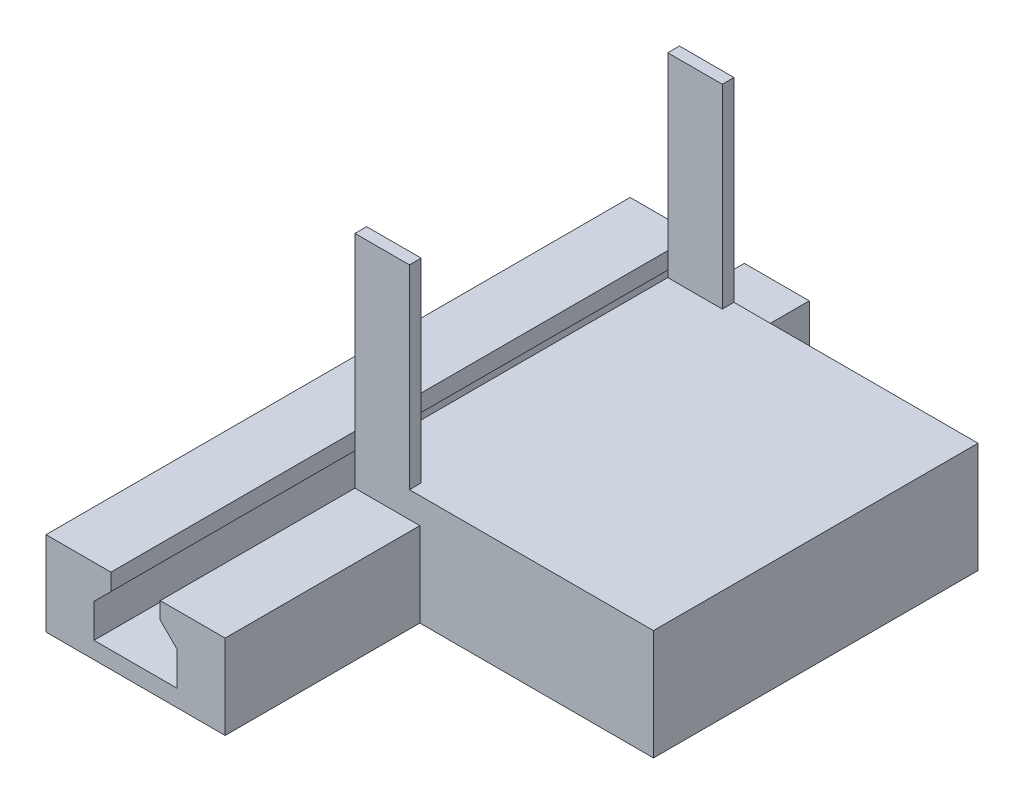
from build123d import *

# Parameters (mm, degrees)
BOSS_EXTRU_1_DEPTH           = 45
ESQUISSE6_W                  = 25
ESQUISSE6_H                  = 7.5
BOSS_EXTRU_6_DEPTH           = 18
ESQUISSE7_W                  = 23
ESQUISSE7_H                  = 25
BOSS_EXTRU_7_DEPTH           = 2
ESQUISSE8_W                  = 4.2
ESQUISSE8_H                  = 0.9
BOSS_EXTRU_8_DEPTH           = 20
BOSS_EXTRU_9_DEPTH           = 10
BOSS_EXTRU_9_DEPTH_BACK      = 5
ESQUISSE9_W                  = 23
ESQUISSE9_H                  = 25
ESQUISSE10_R                 = 4
ENL_V_MAT_EXTRU_1_DEPTH      = 67.483682208
ESQUISSE12_W                 = 23
ESQUISSE12_H                 = 15
ENL_V_MAT_EXTRU_2_DEPTH      = 54.887382568
ENL_V_MAT_EXTRU_3_DEPTH      = 45.86479689
ENL_V_MAT_EXTRU_3_DEPTH_BACK = 45.86479689
ESQUISSE13_W                 = 31.8
ESQUISSE13_H                 = 1


with BuildPart() as part:
    # Esquisse1 → Boss.-Extru.1 (new body)
    with BuildSketch(Plane.XY):
        Polygon((-3.2, 0), (3.2, 0), (3.2, 2.6), (1.9, 3.9), (1.9, 5.2), (6.9, 5.2), (6.9, -2.3), (-6.9, -2.3), (-6.9, 5.2), (-1.9, 5.2), (-1.9, 3.9), (-3.2, 2.6), align=None)
    extrude(amount=BOSS_EXTRU_1_DEPTH)

    # Esquisse6 → Boss.-Extru.6 (add)
    with BuildSketch(Plane(origin=(6.9, 0, 0), x_dir=(0, 0, -1), z_dir=(1, 0, 0))):
        with Locations((-17.5, 1.45)):
            Rectangle(ESQUISSE6_W, ESQUISSE6_H)
    extrude(amount=BOSS_EXTRU_6_DEPTH)

    # Esquisse7 → Boss.-Extru.7 (add)
    with BuildSketch(Plane(origin=(0, 5.2, 0), x_dir=(1, 0, 0), z_dir=(0, 1, 0))):
        with Locations((13.4, -17.5)):
            Rectangle(ESQUISSE7_W, ESQUISSE7_H)
    extrude(amount=BOSS_EXTRU_7_DEPTH)

    # Esquisse8 → Boss.-Extru.8 (add)
    with BuildSketch(Plane(origin=(0, 7.2, 0), x_dir=(1, 0, 0), z_dir=(0, 1, 0))):
        with Locations((4, -29.55)):
            Rectangle(ESQUISSE8_W, ESQUISSE8_H)
        with Locations((4, -5.45)):
            Rectangle(ESQUISSE8_W, ESQUISSE8_H)
    extrude(amount=BOSS_EXTRU_8_DEPTH)

    # Esquisse9 → Boss.-Extru.9 (add, two sides: drawn at the far end of the back side and taken through both)
    with BuildSketch(Plane(origin=(0, 27.2, 0), x_dir=(1, 0, 0), z_dir=(0, 1, 0)).offset(-BOSS_EXTRU_9_DEPTH_BACK)):
        with Locations((13.4, -17.5)):
            Rectangle(ESQUISSE9_W, ESQUISSE9_H)
    extrude(amount=BOSS_EXTRU_9_DEPTH + BOSS_EXTRU_9_DEPTH_BACK)

    # Esquisse10 → Enlèv. mat.-Extru.1 (cut, through all)
    with BuildSketch(Plane(origin=(24.9, 0, 0), x_dir=(0, 0, -1), z_dir=(1, 0, 0))):
        with Locations((-17.5, 29.7)):
            Circle(ESQUISSE10_R)
    extrude(amount=-ENL_V_MAT_EXTRU_1_DEPTH, mode=Mode.SUBTRACT)

    # Esquisse12 → Enlèv. mat.-Extru.2 (cut, through all)
    with BuildSketch(Plane.XY.offset(30)):
        with Locations((13.4, 29.7)):
            Rectangle(ESQUISSE12_W, ESQUISSE12_H)
    extrude(amount=-ENL_V_MAT_EXTRU_2_DEPTH, mode=Mode.SUBTRACT)

    # Esquisse13 → Enlèv. mat.-Extru.3 (cut, two sides: drawn at the far end of the back side and taken through both)
    with BuildSketch(Plane.XY.offset(30).offset(-ENL_V_MAT_EXTRU_3_DEPTH_BACK)):
        with Locations((9, -1.8)):
            Rectangle(ESQUISSE13_W, ESQUISSE13_H)
    extrude(amount=ENL_V_MAT_EXTRU_3_DEPTH + ENL_V_MAT_EXTRU_3_DEPTH_BACK, mode=Mode.SUBTRACT)


solid = part.part
